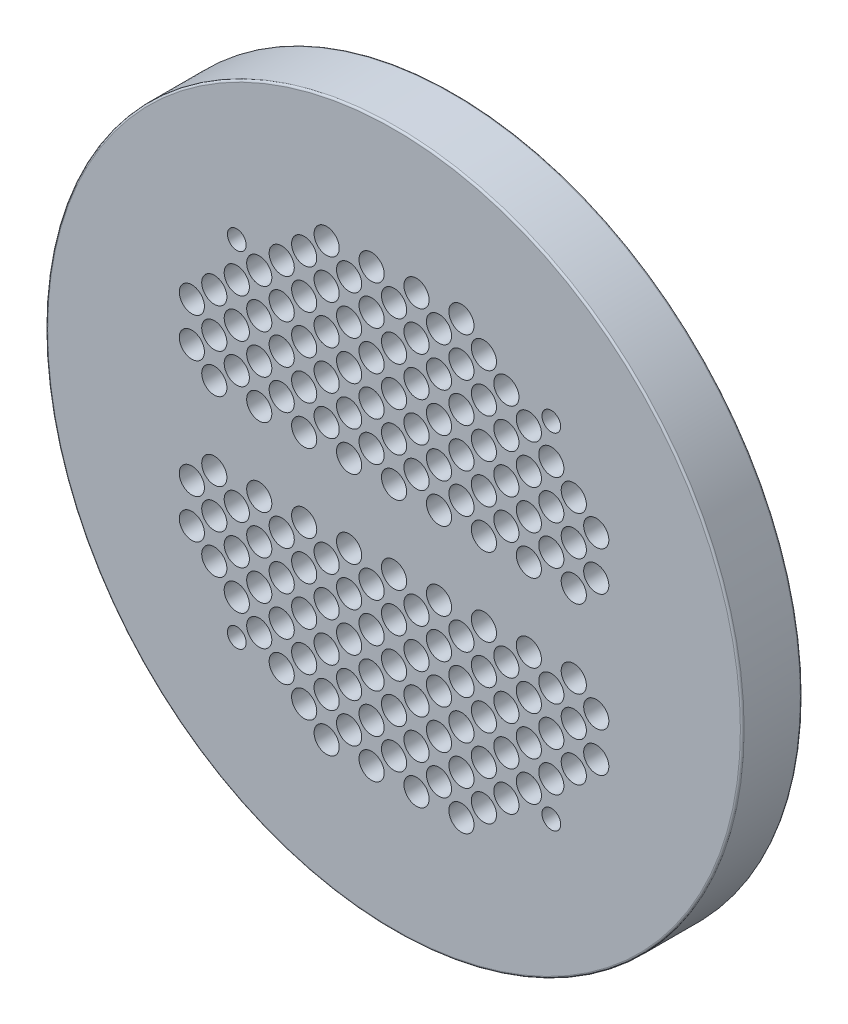
from build123d import *

# Parameters (mm, degrees)
SKETCH1_R               = 295.275
BOSS_EXTRUDE1_DEPTH     = 50.8
FILLET2_R               = 1.5875
CUT_EXTRUDE4_DEPTH      = 421.660541659
CUT_EXTRUDE4_DEPTH_BACK = 421.660541659
SKETCH11_R              = 10.668
SKETCH11_R_2            = 7.9375


with BuildPart() as part:
    # Sketch1 → Boss-Extrude1 (new body)
    with BuildSketch(Plane.XY):
        Circle(SKETCH1_R)
    extrude(amount=BOSS_EXTRUDE1_DEPTH)

    # Fillet2
    fillet2_edges = [part.edges().sort_by_distance(p)[0] for p in [
        (-295.275, 0, 50.8),
        (-295.275, 0, 0),
    ]]
    fillet(fillet2_edges, radius=FILLET2_R)

    # Sketch11 → Cut-Extrude4 (cut, two sides: drawn at the far end of the back side and taken through both)
    with BuildSketch(Plane.XY.offset(-CUT_EXTRUDE4_DEPTH_BACK)):
        with Locations((0, 33.02)):
            Circle(SKETCH11_R)
        with Locations((38.1, 33.02)):
            Circle(SKETCH11_R)
        with Locations((76.2, 33.02)):
            Circle(SKETCH11_R)
        with Locations((114.3, 33.02)):
            Circle(SKETCH11_R)
        with Locations((152.4, 33.02)):
            Circle(SKETCH11_R)
        with Locations((-38.1, 33.02)):
            Circle(SKETCH11_R)
        with Locations((-76.2, 33.02)):
            Circle(SKETCH11_R)
        with Locations((-114.3, 33.02)):
            Circle(SKETCH11_R)
        with Locations((-152.4, 33.02)):
            Circle(SKETCH11_R)
        with Locations((0, 66.3575)):
            Circle(SKETCH11_R)
        with Locations((38.1, 66.3575)):
            Circle(SKETCH11_R)
        with Locations((76.2, 66.3575)):
            Circle(SKETCH11_R)
        with Locations((114.3, 66.3575)):
            Circle(SKETCH11_R)
        with Locations((152.4, 66.3575)):
            Circle(SKETCH11_R)
        with Locations((-38.1, 66.3575)):
            Circle(SKETCH11_R)
        with Locations((-76.2, 66.3575)):
            Circle(SKETCH11_R)
        with Locations((-114.3, 66.3575)):
            Circle(SKETCH11_R)
        with Locations((-152.4, 66.3575)):
            Circle(SKETCH11_R)
        with Locations((0, 99.695)):
            Circle(SKETCH11_R)
        with Locations((38.1, 99.695)):
            Circle(SKETCH11_R)
        with Locations((76.2, 99.695)):
            Circle(SKETCH11_R)
        with Locations((114.3, 99.695)):
            Circle(SKETCH11_R)
        with Locations((152.4, 99.695)):
            Circle(SKETCH11_R)
        with Locations((-38.1, 99.695)):
            Circle(SKETCH11_R)
        with Locations((-76.2, 99.695)):
            Circle(SKETCH11_R)
        with Locations((-114.3, 99.695)):
            Circle(SKETCH11_R)
        with Locations((-133.35, 146.05)):
            Circle(SKETCH11_R_2)
        with Locations((-152.4, 99.695)):
            Circle(SKETCH11_R)
        with Locations((0, 133.0325)):
            Circle(SKETCH11_R)
        with Locations((38.1, 133.0325)):
            Circle(SKETCH11_R)
        with Locations((76.2, 133.0325)):
            Circle(SKETCH11_R)
        with Locations((114.3, 133.0325)):
            Circle(SKETCH11_R)
        with Locations((-38.1, 133.0325)):
            Circle(SKETCH11_R)
        with Locations((-76.2, 133.0325)):
            Circle(SKETCH11_R)
        with Locations((-114.3, 133.0325)):
            Circle(SKETCH11_R)
        with Locations((0, 166.37)):
            Circle(SKETCH11_R)
        with Locations((38.1, 166.37)):
            Circle(SKETCH11_R)
        with Locations((76.2, 166.37)):
            Circle(SKETCH11_R)
        with Locations((-38.1, 166.37)):
            Circle(SKETCH11_R)
        with Locations((-76.2, 166.37)):
            Circle(SKETCH11_R)
        with Locations((19.05, 49.8475)):
            Circle(SKETCH11_R)
        with Locations((-19.05, 49.8475)):
            Circle(SKETCH11_R)
        with Locations((-57.15, 49.8475)):
            Circle(SKETCH11_R)
        with Locations((-95.25, 49.8475)):
            Circle(SKETCH11_R)
        with Locations((-133.35, 49.8475)):
            Circle(SKETCH11_R)
        with Locations((-171.45, 49.8475)):
            Circle(SKETCH11_R)
        with Locations((57.15, 49.8475)):
            Circle(SKETCH11_R)
        with Locations((95.25, 49.8475)):
            Circle(SKETCH11_R)
        with Locations((133.35, 49.8475)):
            Circle(SKETCH11_R)
        with Locations((171.45, 49.8475)):
            Circle(SKETCH11_R)
        with Locations((19.05, 83.185)):
            Circle(SKETCH11_R)
        with Locations((-19.05, 83.185)):
            Circle(SKETCH11_R)
        with Locations((-57.15, 83.185)):
            Circle(SKETCH11_R)
        with Locations((-95.25, 83.185)):
            Circle(SKETCH11_R)
        with Locations((-133.35, 83.185)):
            Circle(SKETCH11_R)
        with Locations((-171.45, 83.185)):
            Circle(SKETCH11_R)
        with Locations((57.15, 83.185)):
            Circle(SKETCH11_R)
        with Locations((95.25, 83.185)):
            Circle(SKETCH11_R)
        with Locations((133.35, 83.185)):
            Circle(SKETCH11_R)
        with Locations((171.45, 83.185)):
            Circle(SKETCH11_R)
        with Locations((19.05, 116.5225)):
            Circle(SKETCH11_R)
        with Locations((-19.05, 116.5225)):
            Circle(SKETCH11_R)
        with Locations((-57.15, 116.5225)):
            Circle(SKETCH11_R)
        with Locations((-95.25, 116.5225)):
            Circle(SKETCH11_R)
        with Locations((-133.35, 116.5225)):
            Circle(SKETCH11_R)
        with Locations((57.15, 116.5225)):
            Circle(SKETCH11_R)
        with Locations((95.25, 116.5225)):
            Circle(SKETCH11_R)
        with Locations((133.35, 116.5225)):
            Circle(SKETCH11_R)
        with Locations((19.05, 149.86)):
            Circle(SKETCH11_R)
        with Locations((-19.05, 149.86)):
            Circle(SKETCH11_R)
        with Locations((-57.15, 149.86)):
            Circle(SKETCH11_R)
        with Locations((-95.25, 149.86)):
            Circle(SKETCH11_R)
        with Locations((57.15, 149.86)):
            Circle(SKETCH11_R)
        with Locations((95.25, 149.86)):
            Circle(SKETCH11_R)
        with Locations((19.05, 183.1975)):
            Circle(SKETCH11_R)
        with Locations((-19.05, 183.1975)):
            Circle(SKETCH11_R)
        with Locations((-57.15, 183.1975)):
            Circle(SKETCH11_R)
        with Locations((57.15, 183.1975)):
            Circle(SKETCH11_R)
        with Locations((-133.35, -146.05)):
            Circle(SKETCH11_R_2)
        with Locations((133.35, -146.05)):
            Circle(SKETCH11_R_2)
        with Locations((133.35, 146.05)):
            Circle(SKETCH11_R_2)
        with Locations((57.15, -183.1975)):
            Circle(SKETCH11_R)
        with Locations((-57.15, -183.1975)):
            Circle(SKETCH11_R)
        with Locations((-19.05, -183.1975)):
            Circle(SKETCH11_R)
        with Locations((19.05, -183.1975)):
            Circle(SKETCH11_R)
        with Locations((95.25, -149.86)):
            Circle(SKETCH11_R)
        with Locations((57.15, -149.86)):
            Circle(SKETCH11_R)
        with Locations((-95.25, -149.86)):
            Circle(SKETCH11_R)
        with Locations((-57.15, -149.86)):
            Circle(SKETCH11_R)
        with Locations((-19.05, -149.86)):
            Circle(SKETCH11_R)
        with Locations((19.05, -149.86)):
            Circle(SKETCH11_R)
        with Locations((133.35, -116.5225)):
            Circle(SKETCH11_R)
        with Locations((95.25, -116.5225)):
            Circle(SKETCH11_R)
        with Locations((57.15, -116.5225)):
            Circle(SKETCH11_R)
        with Locations((-133.35, -116.5225)):
            Circle(SKETCH11_R)
        with Locations((-95.25, -116.5225)):
            Circle(SKETCH11_R)
        with Locations((-57.15, -116.5225)):
            Circle(SKETCH11_R)
        with Locations((-19.05, -116.5225)):
            Circle(SKETCH11_R)
        with Locations((19.05, -116.5225)):
            Circle(SKETCH11_R)
        with Locations((171.45, -83.185)):
            Circle(SKETCH11_R)
        with Locations((133.35, -83.185)):
            Circle(SKETCH11_R)
        with Locations((95.25, -83.185)):
            Circle(SKETCH11_R)
        with Locations((57.15, -83.185)):
            Circle(SKETCH11_R)
        with Locations((-171.45, -83.185)):
            Circle(SKETCH11_R)
        with Locations((-133.35, -83.185)):
            Circle(SKETCH11_R)
        with Locations((-95.25, -83.185)):
            Circle(SKETCH11_R)
        with Locations((-57.15, -83.185)):
            Circle(SKETCH11_R)
        with Locations((-19.05, -83.185)):
            Circle(SKETCH11_R)
        with Locations((19.05, -83.185)):
            Circle(SKETCH11_R)
        with Locations((171.45, -49.8475)):
            Circle(SKETCH11_R)
        with Locations((133.35, -49.8475)):
            Circle(SKETCH11_R)
        with Locations((95.25, -49.8475)):
            Circle(SKETCH11_R)
        with Locations((57.15, -49.8475)):
            Circle(SKETCH11_R)
        with Locations((-171.45, -49.8475)):
            Circle(SKETCH11_R)
        with Locations((-133.35, -49.8475)):
            Circle(SKETCH11_R)
        with Locations((-95.25, -49.8475)):
            Circle(SKETCH11_R)
        with Locations((-57.15, -49.8475)):
            Circle(SKETCH11_R)
        with Locations((-19.05, -49.8475)):
            Circle(SKETCH11_R)
        with Locations((19.05, -49.8475)):
            Circle(SKETCH11_R)
        with Locations((-76.2, -166.37)):
            Circle(SKETCH11_R)
        with Locations((-38.1, -166.37)):
            Circle(SKETCH11_R)
        with Locations((76.2, -166.37)):
            Circle(SKETCH11_R)
        with Locations((38.1, -166.37)):
            Circle(SKETCH11_R)
        with Locations((0, -166.37)):
            Circle(SKETCH11_R)
        with Locations((-114.3, -133.0325)):
            Circle(SKETCH11_R)
        with Locations((-76.2, -133.0325)):
            Circle(SKETCH11_R)
        with Locations((-38.1, -133.0325)):
            Circle(SKETCH11_R)
        with Locations((114.3, -133.0325)):
            Circle(SKETCH11_R)
        with Locations((76.2, -133.0325)):
            Circle(SKETCH11_R)
        with Locations((38.1, -133.0325)):
            Circle(SKETCH11_R)
        with Locations((0, -133.0325)):
            Circle(SKETCH11_R)
        with Locations((-152.4, -99.695)):
            Circle(SKETCH11_R)
        with Locations((-114.3, -99.695)):
            Circle(SKETCH11_R)
        with Locations((-76.2, -99.695)):
            Circle(SKETCH11_R)
        with Locations((-38.1, -99.695)):
            Circle(SKETCH11_R)
        with Locations((152.4, -99.695)):
            Circle(SKETCH11_R)
        with Locations((114.3, -99.695)):
            Circle(SKETCH11_R)
        with Locations((76.2, -99.695)):
            Circle(SKETCH11_R)
        with Locations((38.1, -99.695)):
            Circle(SKETCH11_R)
        with Locations((0, -99.695)):
            Circle(SKETCH11_R)
        with Locations((-152.4, -66.3575)):
            Circle(SKETCH11_R)
        with Locations((-114.3, -66.3575)):
            Circle(SKETCH11_R)
        with Locations((-76.2, -66.3575)):
            Circle(SKETCH11_R)
        with Locations((-38.1, -66.3575)):
            Circle(SKETCH11_R)
        with Locations((152.4, -66.3575)):
            Circle(SKETCH11_R)
        with Locations((114.3, -66.3575)):
            Circle(SKETCH11_R)
        with Locations((76.2, -66.3575)):
            Circle(SKETCH11_R)
        with Locations((38.1, -66.3575)):
            Circle(SKETCH11_R)
        with Locations((0, -66.3575)):
            Circle(SKETCH11_R)
        with Locations((-152.4, -33.02)):
            Circle(SKETCH11_R)
        with Locations((-114.3, -33.02)):
            Circle(SKETCH11_R)
        with Locations((-76.2, -33.02)):
            Circle(SKETCH11_R)
        with Locations((-38.1, -33.02)):
            Circle(SKETCH11_R)
        with Locations((152.4, -33.02)):
            Circle(SKETCH11_R)
        with Locations((114.3, -33.02)):
            Circle(SKETCH11_R)
        with Locations((76.2, -33.02)):
            Circle(SKETCH11_R)
        with Locations((38.1, -33.02)):
            Circle(SKETCH11_R)
        with Locations((0, -33.02)):
            Circle(SKETCH11_R)
    extrude(amount=CUT_EXTRUDE4_DEPTH + CUT_EXTRUDE4_DEPTH_BACK, mode=Mode.SUBTRACT)


solid = part.part
